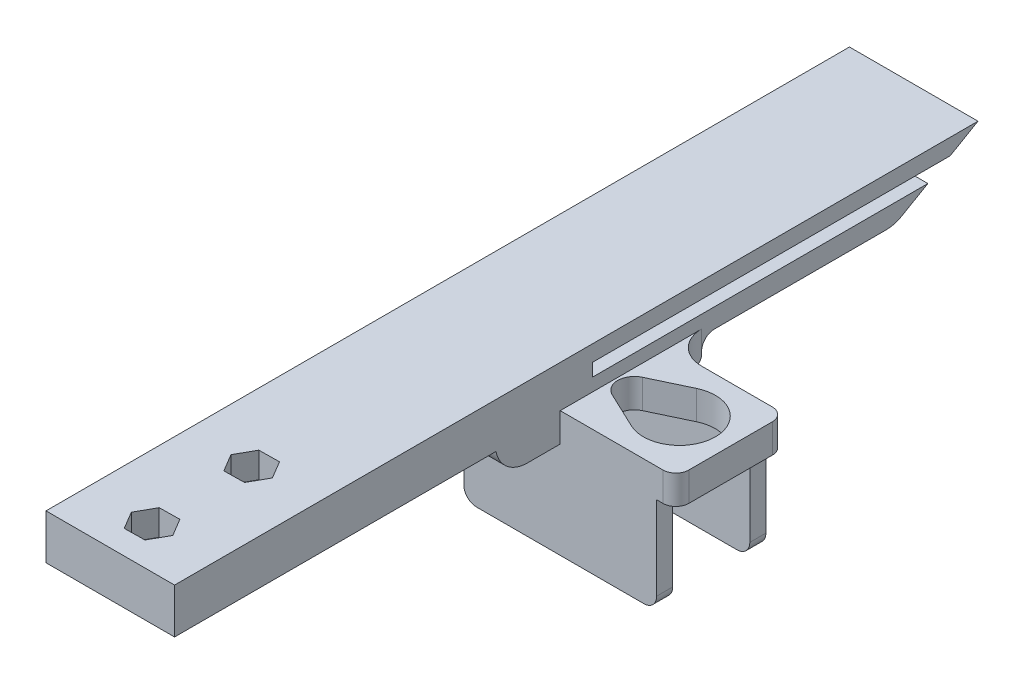
from build123d import *

# Parameters (mm, degrees)
SKETCH1_W                = 20
SKETCH1_H                = 8
BOSS_EXTRUDE1_DEPTH      = 125
CUT_EXTRUDE1_DEPTH       = 60
SKETCH3_W                = 20
SKETCH3_H                = 125
BOSS_EXTRUDE2_DEPTH      = 3
SKETCH5_W                = 4.5
SKETCH5_H                = 2
CUT_EXTRUDE2_DEPTH       = 60
BOSS_EXTRUDE5_DEPTH      = 15
BOSS_EXTRUDE5_DEPTH_BACK = 15
SKETCH9_W                = 2.5
SKETCH9_H                = 15
SKETCH10_W               = 17
SKETCH10_H               = 4.5
BOSS_EXTRUDE6_DEPTH      = 18
CUT_EXTRUDE3_DEPTH       = 129.663032374
CUT_EXTRUDE4_DEPTH       = 4
FILLET1_R                = 5
FILLET2_R                = 3
FILLET3_R                = 5
FILLET4_R                = 2
SKETCH13_W               = 46.736094472
SKETCH13_H               = 46.819354585
CUT_EXTRUDE5_DEPTH       = 30
SKETCH14_W               = 30.537207939
SKETCH14_H               = 50.61246041
CUT_EXTRUDE6_DEPTH       = 3.5
FILLET5_R                = 5
FILLET6_R                = 2
FILLET7_R                = 1
FILLET8_R                = 2
SKETCH15_W               = 20
SKETCH15_H               = 60
CUT_EXTRUDE7_DEPTH       = 5
SKETCH16_W               = 20
SKETCH16_H               = 60
BOSS_EXTRUDE7_DEPTH      = 1.5
SKETCH17_W               = 20
SKETCH17_H               = 10
BOSS_EXTRUDE8_DEPTH      = 4
FILLET9_R                = 5
SKETCH18_R               = 1.75
CUT_EXTRUDE8_DEPTH       = 131.403895283
CUT_EXTRUDE9_DEPTH       = 4


# Some blends are built 0.0001 mm under size
with BuildPart() as part:
    # Sketch1 → Boss-Extrude1 (new body)
    with BuildSketch(Plane.XY):
        with Locations((-16.536312849, 6.223463687)):
            Rectangle(SKETCH1_W, SKETCH1_H)
    extrude(amount=-BOSS_EXTRUDE1_DEPTH)

    # Sketch2 → Cut-Extrude1 (cut)
    with BuildSketch(Plane.XY):
        Polygon((-26.536312849, 7.723463687), (-22.186312849, 7.723463687), (-22.186312849, 5.723463687), (-23.686312849, 5.723463687), (-23.686312849, 4.223463687), (-22.186312849, 4.223463687), (-22.186312849, 2.723463687), (-20.536312849, 2.723463687), (-20.536312849, 7.723463687), (-12.536312849, 7.723463687), (-12.536312849, 2.723463687), (-10.886312849, 2.723463687), (-10.886312849, 4.223463687), (-9.386312849, 4.223463687), (-9.386312849, 5.723463687), (-10.886312849, 5.723463687), (-10.886312849, 7.723463687), (-6.536312849, 7.723463687), (-6.536312849, 2.223463687), (-26.536312849, 2.223463687), align=None)
    extrude(amount=-CUT_EXTRUDE1_DEPTH, mode=Mode.SUBTRACT)

    # Sketch3 → Boss-Extrude2 (add)
    with BuildSketch(Plane(origin=(0, 10.223463687, 0), x_dir=(1, 0, 0), z_dir=(0, 1, 0))):
        with Locations((-16.536312849, 62.5)):
            Rectangle(SKETCH3_W, SKETCH3_H)
    extrude(amount=BOSS_EXTRUDE2_DEPTH)

    # Sketch5 → Cut-Extrude2 (cut)
    with BuildSketch(Plane(origin=(0, 0, -125), x_dir=(-1, 0, 0), z_dir=(0, 0, -1))):
        with Locations((8.786312849, 9.723463687)):
            Rectangle(SKETCH5_W, SKETCH5_H)
        with Locations((24.286312849, 9.723463687)):
            Rectangle(SKETCH5_W, SKETCH5_H)
    extrude(amount=-CUT_EXTRUDE2_DEPTH, mode=Mode.SUBTRACT)

    # Sketch9 → Boss-Extrude5 (add, two sides: drawn at the far end of the back side and taken through both)
    with BuildSketch(Plane(origin=(-6.536312849, 0, 0), x_dir=(0, 0, -1), z_dir=(1, 0, 0)).offset(-BOSS_EXTRUDE5_DEPTH_BACK)):
        with Locations((61.25, -5.276536313)):
            Rectangle(SKETCH9_W, SKETCH9_H)
        with Locations((75.75, -5.276536313)):
            Rectangle(SKETCH9_W, SKETCH9_H)
    extrude(amount=BOSS_EXTRUDE5_DEPTH + BOSS_EXTRUDE5_DEPTH_BACK)

    # Sketch10 → Boss-Extrude6 (add)
    with BuildSketch(Plane(origin=(-6.536312849, 0, 0), x_dir=(0, 0, -1), z_dir=(1, 0, 0))):
        with Locations((68.5, 4.473463687)):
            Rectangle(SKETCH10_W, SKETCH10_H)
    extrude(amount=BOSS_EXTRUDE6_DEPTH)

    # Sketch11 → Cut-Extrude3 (cut, through all)
    with BuildSketch(Plane.XZ.offset(-2.223463687)):
        with BuildLine():
            Line((-4.650598563, -66.193892243), (1.063687151, -63.483368535))
            ThreePointArc((1.063687151, -63.483368535), (9.063687151, -68.543012791), (1.063687151, -73.602657047))
            Line((1.063687151, -73.602657047), (-4.650598563, -70.892133338))
            ThreePointArc((-4.650598563, -70.892133338), (-6.136312849, -68.543012791), (-4.650598563, -66.193892243))
        make_face()
    extrude(amount=-CUT_EXTRUDE3_DEPTH, mode=Mode.SUBTRACT)

    # Sketch12 → Cut-Extrude4 (cut)
    with BuildSketch(Plane.XZ.offset(-2.223463687)):
        Polygon((-14.717314599, -69.706805379), (-14.656689608, -67.398200185), (-16.625687858, -66.191394806), (-18.6553111, -67.293194621), (-18.71593609, -69.601799815), (-16.74693784, -70.808605194), align=None)
    extrude(amount=-CUT_EXTRUDE4_DEPTH, mode=Mode.SUBTRACT)

    # Fillet1
    fillet1_edges = [part.edges().sort_by_distance(p)[0] for p in [
        (-6.536312849, 4.473463687, -77),
    ]]
    fillet(fillet1_edges, radius=FILLET1_R)

    # Fillet2
    fillet2_edges = [part.edges().sort_by_distance(p)[0] for p in [
        (-11.536312849, 2.223463687, -77),
    ]]
    fillet(fillet2_edges, radius=FILLET2_R)

    # Fillet3
    fillet3_edges = [part.edges().sort_by_distance(p)[0] for p in [
        (-21.536312849, 2.223463687, -61.25),
        (-21.536312849, 2.223463687, -77.25),
    ]]
    fillet(fillet3_edges, radius=FILLET3_R - 0.0001)  # a hair under: the kernel refuses the full size

    # Fillet4
    fillet4_edges = [part.edges().sort_by_distance(p)[0] for p in [
        (11.463687151, 4.473463687, -77),
        (11.463687151, 4.473463687, -60),
    ]]
    fillet(fillet4_edges, radius=FILLET4_R)

    # Sketch13 → Cut-Extrude5 (cut)
    with BuildSketch(Plane(origin=(0, -44.208989971, -25.52407226), x_dir=(-1, 0, 0), z_dir=(0, 0.866025403784438, 0.500000000000001))):
        with Locations((16.217588554, -108.832455191)):
            Rectangle(SKETCH13_W, SKETCH13_H)
    extrude(amount=-CUT_EXTRUDE5_DEPTH, mode=Mode.SUBTRACT)

    # Sketch14 → Cut-Extrude6 (cut)
    with BuildSketch(Plane.XZ.offset(-2.223463687)):
        with Locations((-21.804916819, -107.306230205)):
            Rectangle(SKETCH14_W, SKETCH14_H)
    extrude(amount=-CUT_EXTRUDE6_DEPTH, mode=Mode.SUBTRACT)

    # Fillet5
    fillet5_edges = [part.edges().sort_by_distance(p)[0] for p in [
        (-16.536312849, 5.723463687, -112.009618943),
    ]]
    fillet(fillet5_edges, radius=FILLET5_R)

    # Fillet6
    fillet6_edges = [part.edges().sort_by_distance(p)[0] for p in [
        (-16.536312849, 5.723463687, -82),
    ]]
    fillet(fillet6_edges, radius=FILLET6_R)

    # Fillet7
    fillet7_edges = [part.edges().sort_by_distance(p)[0] for p in [
        (-16.536312849, 2.223463687, -82),
    ]]
    fillet(fillet7_edges, radius=FILLET7_R)

    # Fillet8
    fillet8_edges = [part.edges().sort_by_distance(p)[0] for p in [
        (-21.536312849, -12.776536313, -61.25),
        (8.463687151, -12.776536313, -61.25),
        (-21.536312849, -12.776536313, -75.75),
        (8.463687151, -12.776536313, -75.75),
    ]]
    fillet(fillet8_edges, radius=FILLET8_R)

    # Sketch15 → Cut-Extrude7 (cut)
    with BuildSketch(Plane.XZ.offset(-2.723463687)):
        with Locations((-16.536312849, -30)):
            Rectangle(SKETCH15_W, SKETCH15_H)
    extrude(amount=-CUT_EXTRUDE7_DEPTH, mode=Mode.SUBTRACT)

    # Sketch16 → Boss-Extrude7 (add)
    with BuildSketch(Plane.XZ.offset(-7.723463687)):
        with Locations((-16.536312849, -30)):
            Rectangle(SKETCH16_W, SKETCH16_H)
    extrude(amount=BOSS_EXTRUDE7_DEPTH)

    # Sketch17 → Boss-Extrude8 (add)
    with BuildSketch(Plane.XZ.offset(-6.223463687)):
        with Locations((-16.536312849, -55)):
            Rectangle(SKETCH17_W, SKETCH17_H)
    extrude(amount=BOSS_EXTRUDE8_DEPTH)

    # Fillet9
    # the kernel refuses this fillet: 5 mm, written as the material it takes off along each edge
    with BuildSketch(Plane(origin=(5.711135865, 2.223463687, -50), x_dir=(0, 1.0, -1.572075802868717e-12), z_dir=(-1, 0, 0))) as fillet9_piece_1:
        with BuildLine():
            CenterArc((5, 4.898979486), FILLET9_R, 180, 78.463040967)
            Line((0, 4.898979486), (-0.1, 4.898979486))
            Line((-0.1, 4.898979486), (-0.1, 0))
            Line((-0.1, 0), (0, -0.1))
            ThreePointArc((0, -0.1), (2, -0.1), (3.98, -0.09797959))
            Line((3.98, -0.09797959), (4, 0))
        make_face()
    extrude(amount=44.494897428, mode=Mode.SUBTRACT)

    # Sketch18 → Cut-Extrude8 (cut, through all)
    with BuildSketch(Plane(origin=(0, 13.223463687, 0), x_dir=(1, 0, 0), z_dir=(0, 1, 0))):
        with Locations(Location((-16.536312849, 22, 0), (0, 0, 270))):
            Circle(SKETCH18_R)
        with Locations(Location((-16.536312849, 6.5, 0), (0, 0, 270))):
            Circle(SKETCH18_R)
    extrude(amount=-CUT_EXTRUDE8_DEPTH, mode=Mode.SUBTRACT)

    # Sketch19 → Cut-Extrude9 (cut)
    with BuildSketch(Plane(origin=(0, 13.223463687, 0), x_dir=(1, 0, 0), z_dir=(0, 1, 0))):
        Polygon((-18.087719019, 19.224114754), (-14.908028793, 19.268500223), (-13.356622624, 22.044385468), (-14.98490668, 24.775885246), (-18.164596905, 24.731499777), (-19.716003075, 21.955614532), align=None)
        Polygon((-14.908028793, 3.768500223), (-13.356622624, 6.544385468), (-14.98490668, 9.275885246), (-18.164596905, 9.231499777), (-19.716003075, 6.455614532), (-18.087719019, 3.724114754), align=None)
    extrude(amount=-CUT_EXTRUDE9_DEPTH, mode=Mode.SUBTRACT)


solid = part.part
